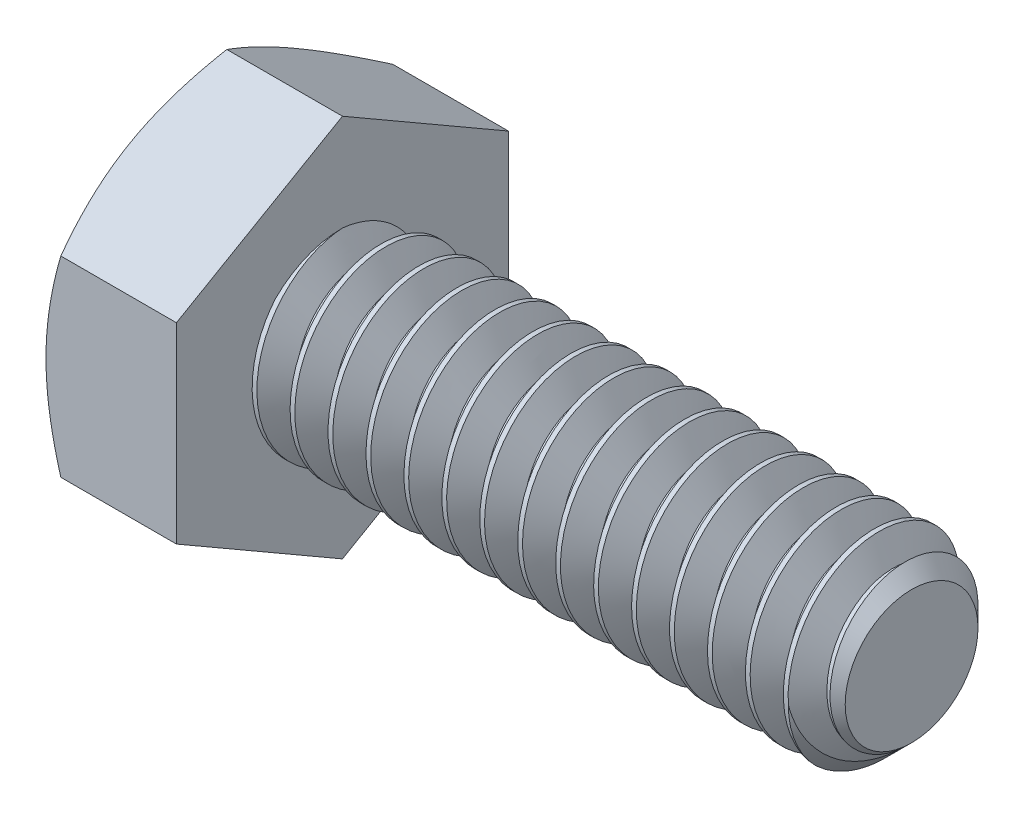
from build123d import *

# Parameters (mm, degrees)
SKETCH5_R           = 3.175
BOSS_EXTRUDE3_DEPTH = 19.05
CHAMFER1_SIZE       = 0.9525
CUT_SWEEP1_PITCH    = 1.27
BOSS_EXTRUDE4_DEPTH = 4.365625
SKETCH8_OUTSIDE_W   = 108.638
SKETCH8_OUTSIDE_H   = 110.358
SKETCH8_OUTSIDE_R   = 5.55625
CUT_EXTRUDE3_DEPTH  = 25.906343918
CUT_EXTRUDE3_DRAFT  = -60


with BuildPart() as part:
    # Sketch5 → Boss-Extrude3 (new body)
    with BuildSketch(Plane(origin=(11.7078125, 0, 0), x_dir=(0, 0, -1), z_dir=(1, 0, 0))):
        Circle(SKETCH5_R)
    extrude(amount=-BOSS_EXTRUDE3_DEPTH)

    # Chamfer1
    chamfer1_edges = [part.edges().sort_by_distance(p)[0] for p in [
        (11.7078125, 0, 3.175),
    ]]
    chamfer(chamfer1_edges, length=CHAMFER1_SIZE)

    # Cut-Sweep1: the profile of Sketch10 profile screwed along a right-hand helix of 16 turns, 8 arcs to a turn; built about Z, then put on its axis
    cut_sweep1_z = Axis((0, 0, 0), (0, 0, 1))
    cut_sweep1_corners = [(3.1753, 0, 0.000173205), (2.350110803, 0, -0.47625), (2.350110803, 0, -0.635), (3.1753, 0, -1.111423205)]
    with BuildLine(mode=Mode.PRIVATE) as cut_sweep1_profile:
        Line(cut_sweep1_corners[0], cut_sweep1_corners[1])
        Line(cut_sweep1_corners[1], cut_sweep1_corners[2])
        Line(cut_sweep1_corners[2], cut_sweep1_corners[3])
        Line(cut_sweep1_corners[3], cut_sweep1_corners[0])
    cut_sweep1_cap = Face(cut_sweep1_profile.wire())
    cut_sweep1_turn_angles = [0, 22.5, 45, 67.5, 90, 112.5, 135, 157.5, 180, 202.5, 225, 247.5, 270, 292.5, 315, 337.5, 360]
    cut_sweep1_turn_weights = [1, 0.9238795325112867, 1, 0.9238795325112867, 1, 0.9238795325112867, 1, 0.9238795325112867, 1, 0.9238795325112867, 1, 0.9238795325112867, 1, 0.9238795325112867, 1, 0.9238795325112867, 1]
    cut_sweep1_turn_rails = [Edge.make_bspline([Vector(p[0], p[1], 0).rotate(cut_sweep1_z, cut_sweep1_turn_angles[k]) / cut_sweep1_turn_weights[k] + Vector(0, 0, p[2] + CUT_SWEEP1_PITCH * cut_sweep1_turn_angles[k] / 360) for k in range(17)], [0, 0, 0, 1, 1, 2, 2, 3, 3, 4, 4, 5, 5, 6, 6, 7, 7, 8, 8, 8], 2, cut_sweep1_turn_weights) for p in cut_sweep1_corners]
    cut_sweep1_turn_sides = [Face.make_surface_from_curves(cut_sweep1_turn_rails[p[0]], cut_sweep1_turn_rails[p[1]]) for p in [(0, 1), (1, 2), (2, 3), (3, 0)]]
    cut_sweep1 = Plane(origin=(11.7078125, 0, 0), x_dir=(0, 1, 0), z_dir=(-1, 0, 0)) * Solid(Shell([*[p.moved(Location((0, 0, CUT_SWEEP1_PITCH * i))) for i in range(16) for p in cut_sweep1_turn_sides], cut_sweep1_cap, cut_sweep1_cap.rotate(cut_sweep1_z, 5760).moved(Location((0, 0, CUT_SWEEP1_PITCH * 5760 / 360)))]))
    add(cut_sweep1, mode=Mode.SUBTRACT)

    # Sketch6 → Boss-Extrude4 (add)
    with BuildSketch(Plane.ZY.offset(7.3421875)):
        Polygon((5.55625, 3.207902433), (0, 6.415804866), (-5.55625, 3.207902433), (-5.55625, -3.207902433), (0, -6.415804866), (5.55625, -3.207902433), align=None)
    extrude(amount=BOSS_EXTRUDE4_DEPTH)


with BuildPart() as cut_extrude3_tool:
    # Sketch8 outside → Cut-Extrude3 (with draft: the straight prism first)
    with BuildSketch(Plane.ZY.offset(11.7078125)):
        Rectangle(SKETCH8_OUTSIDE_W, SKETCH8_OUTSIDE_H)
        Circle(SKETCH8_OUTSIDE_R, mode=Mode.SUBTRACT)
    extrude(amount=-CUT_EXTRUDE3_DEPTH)
    # Cut-Extrude3: the draft: its side faces are tilted about the plane it starts from
    cut_extrude3_sides = [cut_extrude3_tool.faces().sort_by_distance(p)[0] for p in [
        (1.245359459, -55.179, 0),
        (1.245359459, 0, 54.319),
        (1.245359459, 55.179, 0),
        (1.245359459, 0, -54.319),
        (1.245359459, 0, -5.55625),
    ]]
    draft(cut_extrude3_sides, Plane.ZY.offset(11.7078125), CUT_EXTRUDE3_DRAFT)


with BuildPart() as part_1:
    add(part.part)

    # Cut-Extrude3: cut by cut_extrude3_tool
    add(cut_extrude3_tool.part, mode=Mode.SUBTRACT)


solid = part_1.part
